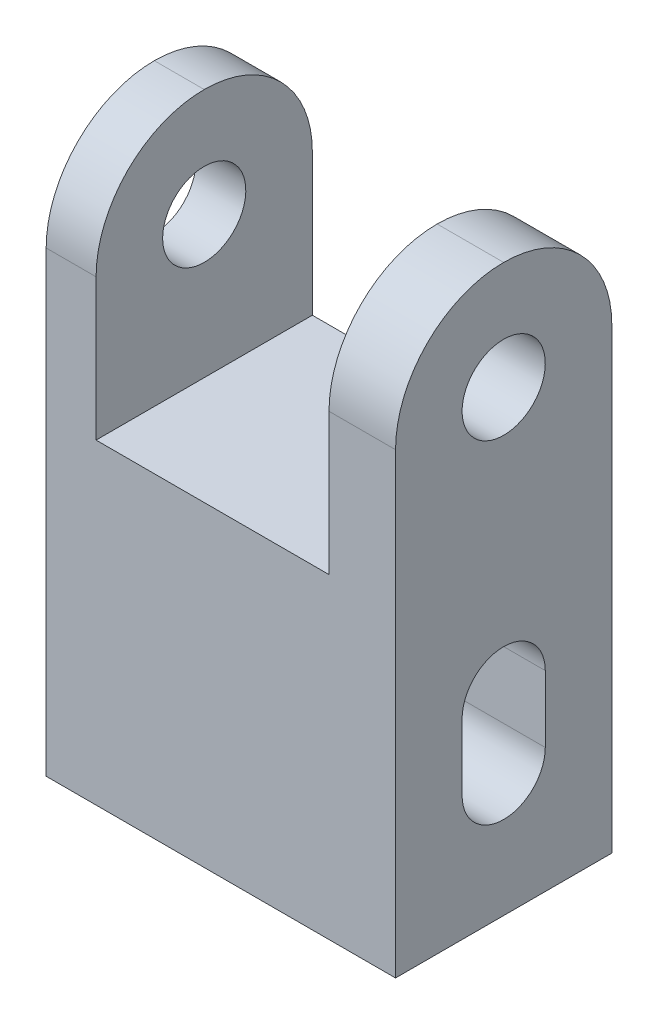
from build123d import *

# Parameters (mm, degrees)
BOSS_EXTRUDE1_DEPTH     = 13
CUT_EXTRUDE1_DEPTH      = 43.023802779
CUT_EXTRUDE2_DEPTH      = 43.023802779
CUT_EXTRUDE2_DEPTH_BACK = 43.023802779
SKETCH5_R               = 2.5
FILLET1_R               = 6.5
SKETCH6_R               = 2
CUT_EXTRUDE3_DEPTH      = 8


with BuildPart() as part:
    # Sketch2 → Boss-Extrude1 (new body)
    with BuildSketch(Plane.XY):
        Polygon((0, 0), (0, -34), (21, -34), (21, 0), (17, 0), (17, -15), (3, -15), (3, 0), align=None)
    extrude(amount=BOSS_EXTRUDE1_DEPTH)

    # Sketch4 → Cut-Extrude1 (cut, through all)
    with BuildSketch(Plane.ZY):
        with BuildLine():
            Line((4, -26.5), (4, -22.5))
            ThreePointArc((4, -22.5), (6.5, -20), (9, -22.5))
            Line((9, -22.5), (9, -26.5))
            ThreePointArc((9, -26.5), (6.5, -29), (4, -26.5))
        make_face()
    extrude(amount=-CUT_EXTRUDE1_DEPTH, mode=Mode.SUBTRACT)

    # Sketch5 → Cut-Extrude2 (cut, two sides: drawn at the far end of the back side and taken through both)
    with BuildSketch(Plane(origin=(21, 0, 0), x_dir=(0, 0, -1), z_dir=(1, 0, 0)).offset(-CUT_EXTRUDE2_DEPTH_BACK)):
        with Locations(Location((-6.5, -6.5, 0), (0, 0, 90))):
            Circle(SKETCH5_R)
    extrude(amount=CUT_EXTRUDE2_DEPTH + CUT_EXTRUDE2_DEPTH_BACK, mode=Mode.SUBTRACT)

    # Fillet1
    fillet1_edges = [part.edges().sort_by_distance(p)[0] for p in [
        (19, 0, 13),
        (1.5, 0, 13),
        (1.5, 0, 0),
        (19, 0, 0),
    ]]
    fillet(fillet1_edges, radius=FILLET1_R - 0.0001)  # a hair under: the kernel refuses the full size

    # Sketch6 → Cut-Extrude3 (cut)
    with BuildSketch(Plane.XZ.offset(34)):
        with Locations((10.5, 6.5)):
            Circle(SKETCH6_R)
    extrude(amount=-CUT_EXTRUDE3_DEPTH, mode=Mode.SUBTRACT)


solid = part.part
